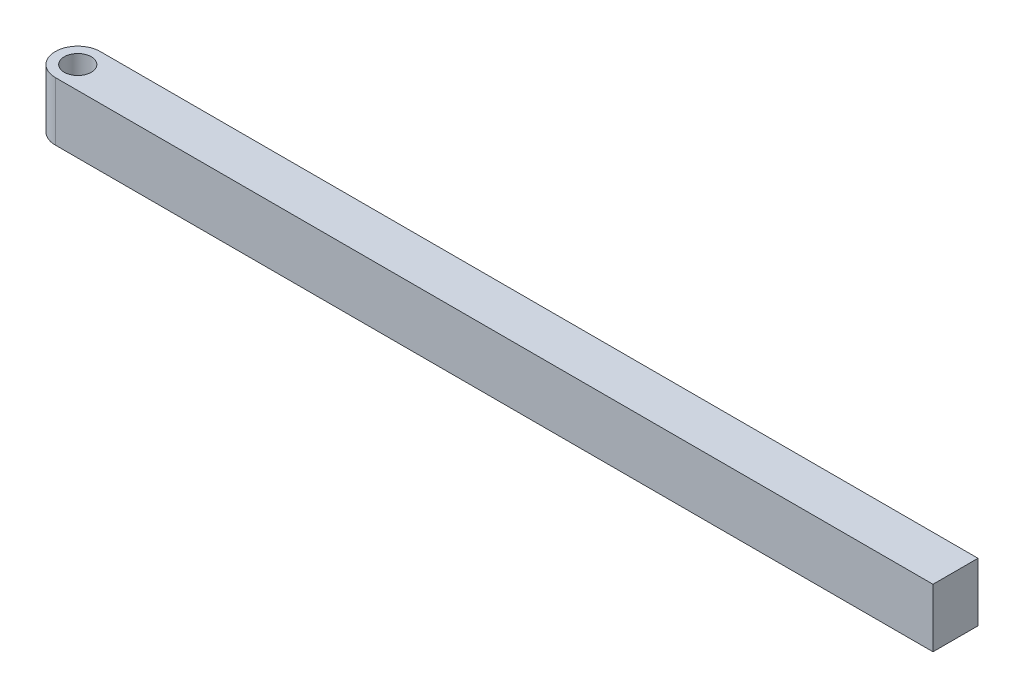
from build123d import *

# Parameters (mm, degrees)
SKETCH1_W           = 13
SKETCH1_H           = 10
BOSS_EXTRUDE1_DEPTH = 200
SKETCH2_R           = 3
CUT_EXTRUDE1_DEPTH  = 201.484413359
FILLET1_R           = 5


with BuildPart() as part:
    # Sketch1 → Boss-Extrude1 (new body)
    with BuildSketch(Plane.YZ):
        Rectangle(SKETCH1_W, SKETCH1_H)
    extrude(amount=BOSS_EXTRUDE1_DEPTH)

    # Sketch2 → Cut-Extrude1 (cut, through all)
    with BuildSketch(Plane(origin=(0, 6.5, 0), x_dir=(-1, 0, 0), z_dir=(0, 1, 0))):
        with Locations(Location((-5, 0, 0), (0, 0, 90))):
            Circle(SKETCH2_R)
    extrude(amount=-CUT_EXTRUDE1_DEPTH, mode=Mode.SUBTRACT)

    # Fillet1
    fillet1_edges = [part.edges().sort_by_distance(p)[0] for p in [
        (0, 0, 5),
        (0, 0, -5),
    ]]
    fillet(fillet1_edges, radius=FILLET1_R - 0.0001)  # a hair under: the kernel refuses the full size


solid = part.part
